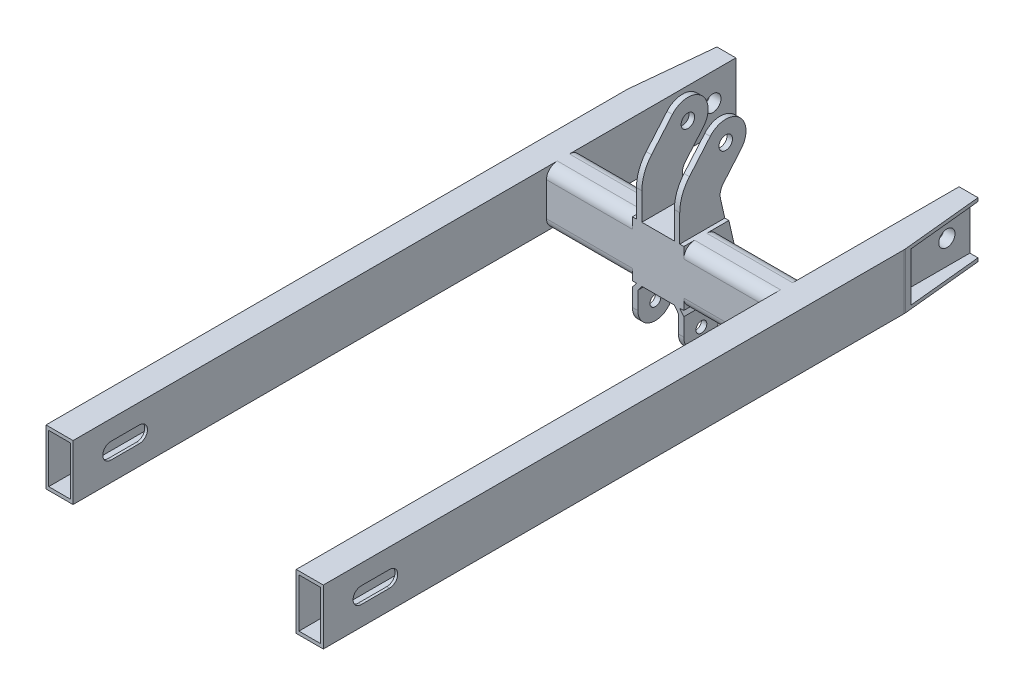
from build123d import *

# Parameters (mm, degrees)
EXTRUDE_1_DEPTH     = 41
FILLET_4_R          = 8
SKETCH_2_R          = 6
CUT_EXTRUDE_1_DEPTH = 115.5
SKETCH_3_W          = 16
SKETCH_3_H          = 36
CUT_EXTRUDE_2_DEPTH = 400
SKETCH_4_W          = 70
SKETCH_4_H          = 36
CUT_EXTRUDE_3_DEPTH = 12
FILLET_5_R          = 12
FILLET_6_R          = 12
SKETCH_5_R          = 4
SKETCH_5_R_2        = 5
EXTRUDE_2_DEPTH     = 19
SKETCH_6_W          = 3
SKETCH_6_H          = 63
SKETCH_6_W_2        = 24
CUT_EXTRUDE_4_DEPTH = 68


with BuildPart() as part:
    # Эскиз1 → Бобышка-Вытянуть1 (new body)
    with BuildSketch(Plane(origin=(0, 0, 0), x_dir=(1, 0, 0), z_dir=(0, 1, 0))):
        Polygon((0, 0), (14, 0), (20, -60), (20, -490), (0, -490), (0, -140), (-165, -140), (-165, -490), (-185, -490), (-185, -60), (-179, 0), (-165, 0), (-165, -115), (0, -115), align=None)
    extrude(amount=EXTRUDE_1_DEPTH)

    # Скругление4
    fillet_4_edges = [part.edges().sort_by_distance(p)[0] for p in [
        (-82.5, 0, 140),
        (-82.5, 0, 115),
        (-82.5, 41, 140),
        (-82.5, 41, 115),
    ]]
    fillet(fillet_4_edges, radius=FILLET_4_R)

    # Эскиз2 → Вырез-Вытянуть1 (cut, symmetric)
    with BuildSketch(Plane(origin=(-82.5, 0, 0), x_dir=(0, 0, -1), z_dir=(1, 0, 0))):
        with Locations((-17, 20.5)):
            Circle(SKETCH_2_R)
        with BuildLine():
            Line((-462, 26.5), (-441, 26.5))
            ThreePointArc((-441, 26.5), (-435, 20.5), (-441, 14.5))
            Line((-441, 14.5), (-462, 14.5))
            ThreePointArc((-462, 14.5), (-468, 20.5), (-462, 26.5))
        make_face()
    extrude(amount=CUT_EXTRUDE_1_DEPTH, both=True, mode=Mode.SUBTRACT)

    # Эскиз3 → Вырез-Вытянуть2 (cut)
    with BuildSketch(Plane.XY.offset(490)):
        with Locations((10, 20.5)):
            Rectangle(SKETCH_3_W, SKETCH_3_H)
        with Locations((-175, 20.5)):
            Rectangle(SKETCH_3_W, SKETCH_3_H)
    extrude(amount=-CUT_EXTRUDE_2_DEPTH, mode=Mode.SUBTRACT)

    # Эскиз4 → Вырез-Вытянуть3 (cut)
    with BuildSketch(Plane.ZY.offset(185)):
        with Locations((20, 20.5)):
            Rectangle(SKETCH_4_W, SKETCH_4_H)
    cut_extrude_3 = extrude(amount=-CUT_EXTRUDE_3_DEPTH, mode=Mode.SUBTRACT)

    # Зеркальное отражение1: Вырез-Вытянуть3 across plane
    add(cut_extrude_3.mirror(Plane(origin=(-82.5, 0, 0), x_dir=(0, 0, 1), z_dir=(1, 0, 0))), mode=Mode.SUBTRACT)

    # Скругление5
    # the kernel refuses this fillet: 12 mm, written as the material it takes off along each edge
    with BuildSketch(Plane(origin=(20, -1.496268634, 60), x_dir=(-0.0995037190210001, 0, -0.995037190209989), z_dir=(0, 1, 0))) as fillet_5_piece_1:
        with BuildLine():
            CenterArc((FILLET_5_R * 0.0498756211209, FILLET_5_R), FILLET_5_R, 264.289406863, 5.710593137)
            Line((-FILLET_5_R * 0.0496280979001, FILLET_5_R * 0.00496280979001), (0, 0))
            Line((0, 0), (FILLET_5_R * 0.0498756211209, 0))
        make_face()
    extrude(amount=43.992537267, mode=Mode.SUBTRACT)

    # Скругление6
    # the kernel refuses this fillet: 12 mm, written as the material it takes off along each edge
    with BuildSketch(Plane(origin=(-185, -1.496268634, 60), x_dir=(0.09950371902099304, 0, -0.9950371902099898), z_dir=(0, 1, 0))) as fillet_6_piece_1:
        with BuildLine():
            CenterArc((FILLET_6_R * 0.0498756211209, -FILLET_6_R), FILLET_6_R, 90, 5.710593137)
            Line((-FILLET_6_R * 0.0496280979001, -FILLET_6_R * 0.00496280979001), (0, 0))
            Line((0, 0), (FILLET_6_R * 0.0498756211209, 0))
        make_face()
    extrude(amount=43.992537267, mode=Mode.SUBTRACT)

    # Эскиз5 → Бобышка-Вытянуть2 (add, symmetric)
    with BuildSketch(Plane(origin=(-82.5, 0, 0), x_dir=(0, 0, -1), z_dir=(1, 0, 0))):
        with BuildLine():
            Line((-140, 61.173848335), (-140, -17))
            ThreePointArc((-140, -17), (-128.913133611, -29.858457131), (-114.563089264, -20.784607158))
            Line((-114.563089264, -20.784607158), (-103.54711014, 15.415913355))
            ThreePointArc((-103.54711014, 15.415913355), (-102.693554475, 20.5247626), (-103.180589505, 25.681476162))
            Line((-103.180589505, 25.681476162), (-109.885999017, 55.110773465))
            ThreePointArc((-109.885999017, 55.110773465), (-109.847393001, 59.716977585), (-107.748140134, 63.81719029))
            Line((-107.748140134, 63.81719029), (-94.581616231, 79.272692454))
            ThreePointArc((-94.581616231, 79.272692454), (-96.272692454, 100.418383769), (-117.418383769, 98.727307546))
            Line((-117.418383769, 98.727307546), (-132.836767538, 80.628463428))
            ThreePointArc((-132.836767538, 80.628463428), (-138.152291436, 71.539584533), (-140, 61.173848335))
        make_face()
        with Locations((-127, -17)):
            Circle(SKETCH_5_R, mode=Mode.SUBTRACT)
        with Locations((-106, 89)):
            Circle(SKETCH_5_R_2, mode=Mode.SUBTRACT)
    extrude(amount=EXTRUDE_2_DEPTH, both=True)

    # Эскиз6 → Вырез-Вытянуть4 (cut)
    with BuildSketch(Plane.XY.offset(140)):
        with Locations((-100, 72.5)):
            Rectangle(SKETCH_6_W, SKETCH_6_H)
        Polygon((-101.513854398, -4), (-98.5, 0), (-101.5, 0), align=None)
        Polygon((-94.5, 0), (-70.5, 0), (-67.5, -4), (-67.5, -30), (-97.5, -30), (-97.5, -4), align=None)
        with Locations((-82.5, 72.5)):
            Rectangle(SKETCH_6_W_2, SKETCH_6_H)
        Polygon((-63.486145602, -4), (-63.5, 0), (-66.5, 0), align=None)
        with Locations((-65, 72.5)):
            Rectangle(SKETCH_6_W, SKETCH_6_H)
    extrude(amount=-CUT_EXTRUDE_4_DEPTH, mode=Mode.SUBTRACT)


solid = part.part
